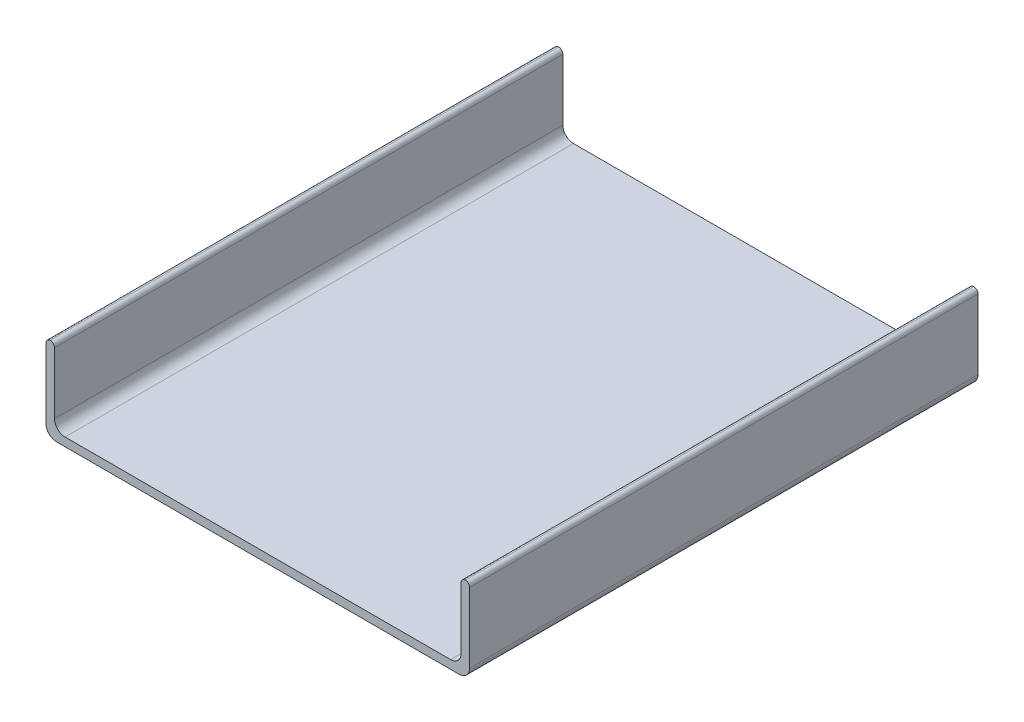
from build123d import *

# Parameters (mm, degrees)
BOSS_EXTRUDE3_DEPTH = 120
FILLET4_R           = 1


with BuildPart() as part:
    # Sketch5 → Boss-Extrude3 (new body)
    with BuildSketch(Plane.XY):
        with BuildLine():
            Line((-2.689552127, 0.955752212), (88.310447873, 0.955752212))
            ThreePointArc((88.310447873, 0.955752212), (90.078214826, 1.687985259), (90.810447873, 3.455752212))
            Line((90.810447873, 3.455752212), (90.810447873, 18.955752212))
            Line((90.810447873, 18.955752212), (92.810447873, 18.955752212))
            Line((92.810447873, 18.955752212), (92.810447873, 2.955752212))
            Line((92.810447873, 2.955752212), (92.810447873, 1.455752212))
            ThreePointArc((92.810447873, 1.455752212), (92.078214826, -0.312014741), (90.310447873, -1.044247788))
            Line((90.310447873, -1.044247788), (-4.689552127, -1.044247788))
            ThreePointArc((-4.689552127, -1.044247788), (-6.45731908, -0.312014741), (-7.189552127, 1.455752212))
            Line((-7.189552127, 1.455752212), (-7.189552127, 2.955752212))
            Line((-7.189552127, 2.955752212), (-7.189552127, 18.955752212))
            Line((-7.189552127, 18.955752212), (-5.189552127, 18.955752212))
            Line((-5.189552127, 18.955752212), (-5.189552127, 3.455752212))
            ThreePointArc((-5.189552127, 3.455752212), (-4.45731908, 1.687985259), (-2.689552127, 0.955752212))
        make_face()
    extrude(amount=BOSS_EXTRUDE3_DEPTH)

    # Fillet4
    fillet4_edges = [part.edges().sort_by_distance(p)[0] for p in [
        (92.810447873, 18.955752212, 60),
        (90.810447873, 18.955752212, 60),
        (-7.189552127, 18.955752212, 60),
        (-5.189552127, 18.955752212, 60),
    ]]
    fillet(fillet4_edges, radius=FILLET4_R - 0.0001)  # a hair under: the kernel refuses the full size


solid = part.part
